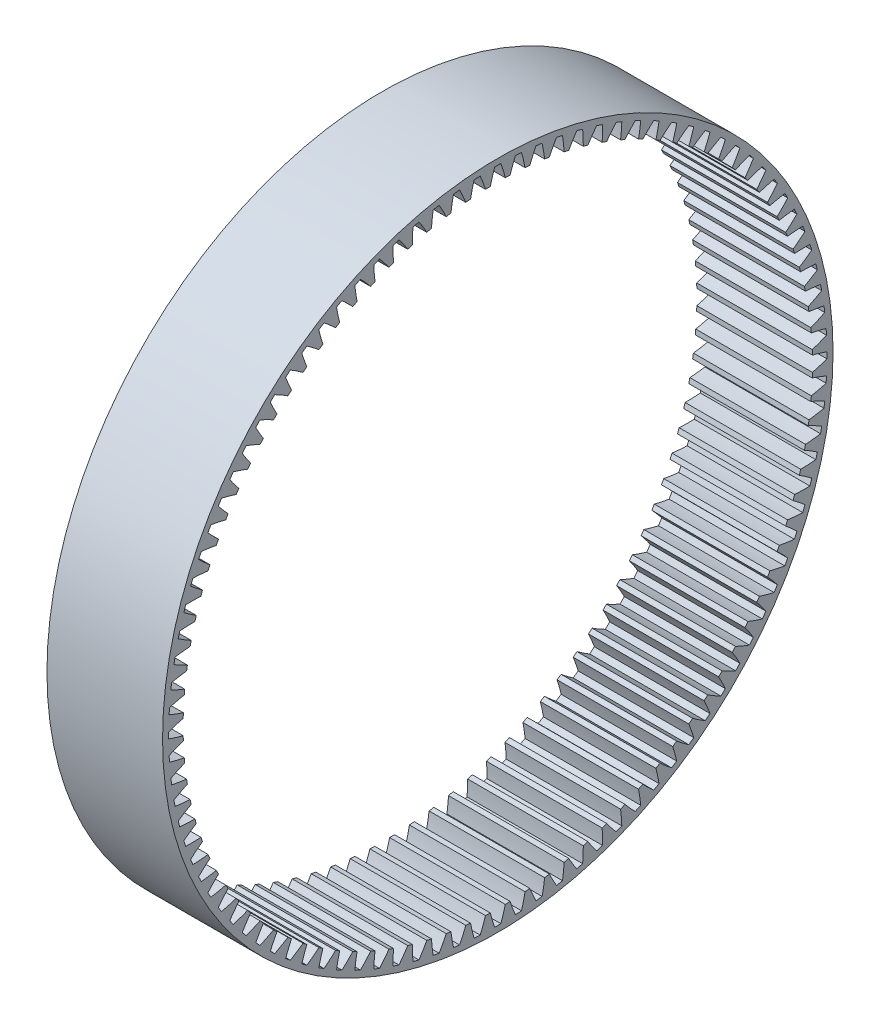
from build123d import *

# Parameters (mm, degrees)
BASPROSKE_W     = 38.1
BASPROSKE_H     = 6.773333333
TOOTHCUT_DEPTH  = 161.834356404
TEETHCUTS_COUNT = 100
TEETHCUTS_ANGLE = 356.4


with BuildPart() as part:
    # BasProSke → Base-Revolve (revolve)
    with BuildSketch(Plane(origin=(0, 0, 0), x_dir=(1, 0, 0), z_dir=(0, 1, 0))):
        with Locations((19.05, 107.103333334)):
            Rectangle(BASPROSKE_W, BASPROSKE_H)
    revolve(axis=Axis((-10, 0, 0), (1, 0, 0)))

    # TooCutSke → ToothCut (cut, through all)
    with BuildSketch(Plane(origin=(0, 0, 0), x_dir=(0, 0, -1), z_dir=(1, 0, 0))):
        with BuildLine():
            ThreePointArc((2.467591635, 103.661901268), (1.794761249, 106.086190234), (1.007461008, 108.475758406))
            ThreePointArc((1.007461008, 108.475758406), (0, 108.480436667), (-1.007461008, 108.475758406))
            ThreePointArc((-1.007461008, 108.475758406), (-1.794761249, 106.086190234), (-2.467591635, 103.661901268))
            ThreePointArc((-2.467591635, 103.661901268), (0, 103.691266667), (2.467591635, 103.661901268))
        make_face()
    toothcut = extrude(amount=TOOTHCUT_DEPTH, mode=Mode.SUBTRACT)

    # TeethCuts: ToothCut ×100 about axis
    teethcuts_axis = Axis((-10, 0, 0), (1, 0, 0))
    for i in range(1, TEETHCUTS_COUNT):
        add(toothcut.rotate(teethcuts_axis, i * TEETHCUTS_ANGLE / (TEETHCUTS_COUNT - 1)), mode=Mode.SUBTRACT)


solid = part.part
